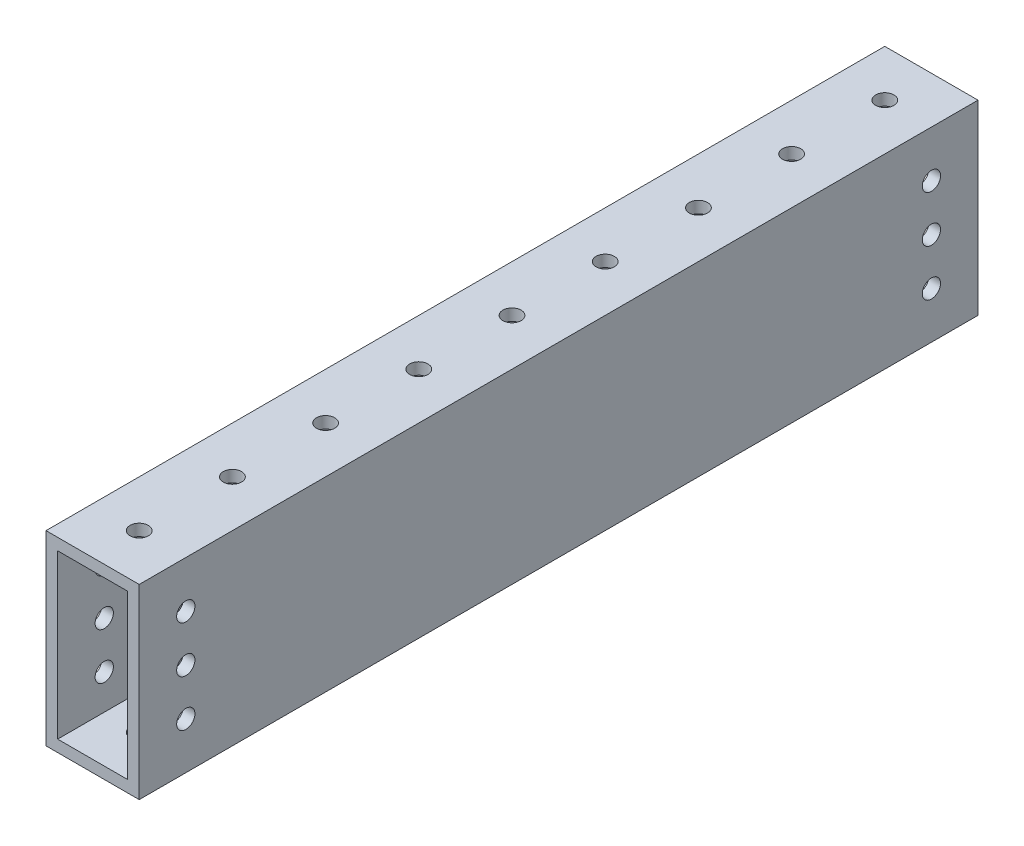
from build123d import *

# Parameters (mm, degrees)
SKETCH1_W           = 25.4
SKETCH1_H           = 50.8
SKETCH1_W_2         = 19.05
SKETCH1_H_2         = 44.45
BOSS_EXTRUDE1_DEPTH = 114.3
SKETCH2_R           = 2.4892
CUT_EXTRUDE1_DEPTH  = 126.723585695
SKETCH3_R           = 2.4892
CUT_EXTRUDE2_DEPTH  = 120.811560377


with BuildPart() as part:
    # Sketch1 → Boss-Extrude1 (new, symmetric)
    with BuildSketch(Plane.XY):
        Rectangle(SKETCH1_W, SKETCH1_H)
        Rectangle(SKETCH1_W_2, SKETCH1_H_2, mode=Mode.SUBTRACT)
    extrude(amount=BOSS_EXTRUDE1_DEPTH, both=True)

    # Sketch2 → Cut-Extrude1 (cut, through all)
    with BuildSketch(Plane(origin=(0, 25.4, 0), x_dir=(1, 0, 0), z_dir=(0, 1, 0))):
        with Locations((0, -101.6)):
            Circle(SKETCH2_R)
        with Locations((0, -76.2)):
            Circle(SKETCH2_R)
        with Locations((0, -50.8)):
            Circle(SKETCH2_R)
        with Locations((0, -25.4)):
            Circle(SKETCH2_R)
        Circle(SKETCH2_R)
        with Locations((0, 25.4)):
            Circle(SKETCH2_R)
        with Locations((0, 50.8)):
            Circle(SKETCH2_R)
        with Locations((0, 76.2)):
            Circle(SKETCH2_R)
        with Locations((0, 101.6)):
            Circle(SKETCH2_R)
    extrude(amount=-CUT_EXTRUDE1_DEPTH, mode=Mode.SUBTRACT)

    # Sketch3 → Cut-Extrude2 (cut, through all)
    with BuildSketch(Plane.ZY.offset(12.7)):
        with Locations((101.6, 0)):
            Circle(SKETCH3_R)
        with Locations((101.6, -12.7)):
            Circle(SKETCH3_R)
        with Locations((101.6, 12.7)):
            Circle(SKETCH3_R)
    cut_extrude2 = extrude(amount=-CUT_EXTRUDE2_DEPTH, mode=Mode.SUBTRACT)

    # Mirror1: Cut-Extrude2 across plane
    add(cut_extrude2.mirror(Plane.XY), mode=Mode.SUBTRACT)


solid = part.part
